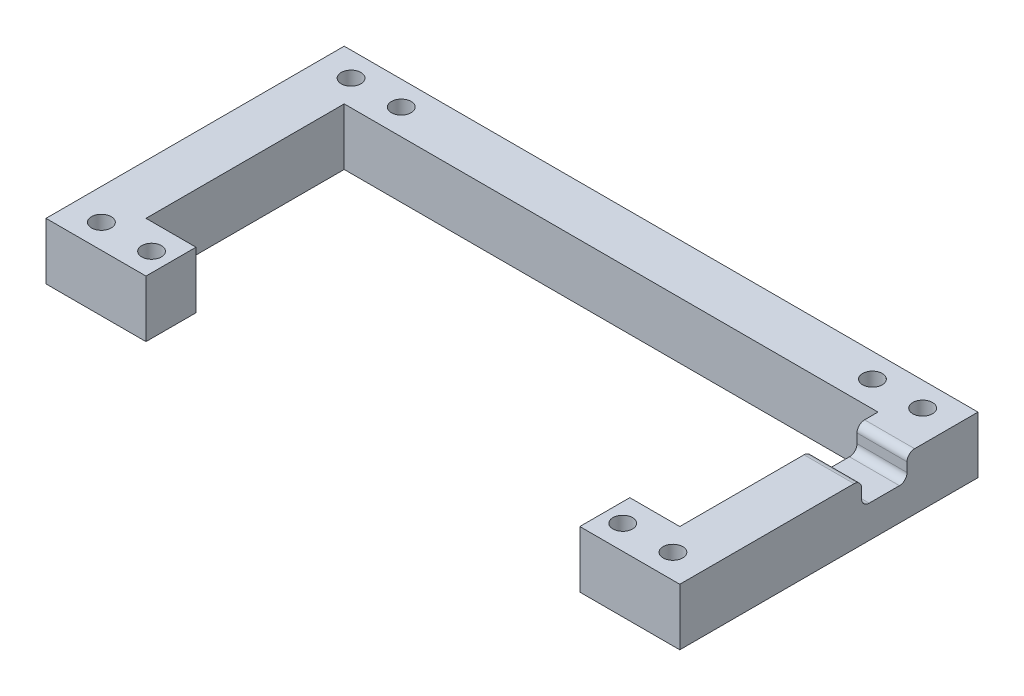
from build123d import *

# Parameters (mm, degrees)
SKETCH1_R           = 1.651
BOSS_EXTRUDE1_DEPTH = 9.525
SKETCH2_W           = 7.62
SKETCH2_H           = 4.099575227
CUT_EXTRUDE7_DEPTH  = 8.89
FILLET2_R           = 1.27


with BuildPart() as part:
    # Sketch1 → Boss-Extrude1 (new body)
    with BuildSketch(Plane(origin=(0, 0, 0), x_dir=(1, 0, 0), z_dir=(0, 1, 0))):
        Polygon((75.155177047, 61.997896552), (75.155177047, 11.997896552), (91.919177047, 11.997896552), (91.919177047, 20.379896552), (83.537177047, 20.379896552), (83.537177047, 53.615896552), (173.037829354, 53.615896552), (173.037829354, 20.379896552), (164.655829354, 20.379896552), (164.655829354, 11.997896552), (181.419829354, 11.997896552), (181.419829354, 61.997896552), align=None)
        with Locations((80.3721812, 16.064784874)):
            Circle(SKETCH1_R, mode=Mode.SUBTRACT)
        with Locations((80.3721812, 57.93100823)):
            Circle(SKETCH1_R, mode=Mode.SUBTRACT)
        with Locations((167.7875512, 57.93100823)):
            Circle(SKETCH1_R, mode=Mode.SUBTRACT)
        with Locations((88.7874552, 57.93100823)):
            Circle(SKETCH1_R, mode=Mode.SUBTRACT)
        with Locations((88.7874552, 16.064784874)):
            Circle(SKETCH1_R, mode=Mode.SUBTRACT)
        with Locations((176.2028252, 57.93100823)):
            Circle(SKETCH1_R, mode=Mode.SUBTRACT)
        with Locations((176.2028252, 16.064784874)):
            Circle(SKETCH1_R, mode=Mode.SUBTRACT)
        with Locations((167.7875512, 16.064784874)):
            Circle(SKETCH1_R, mode=Mode.SUBTRACT)
    extrude(amount=BOSS_EXTRUDE1_DEPTH)

    # Sketch2 → Cut-Extrude7 (cut)
    with BuildSketch(Plane(origin=(181.419829354, 0, 0), x_dir=(0, 0, -1), z_dir=(1, 0, 0))):
        with Locations((46.287896552, 7.475212387)):
            Rectangle(SKETCH2_W, SKETCH2_H)
    extrude(amount=-CUT_EXTRUDE7_DEPTH, mode=Mode.SUBTRACT)

    # Fillet2
    fillet2_edges = [part.edges().sort_by_distance(p)[0] for p in [
        (177.228829354, 5.425424773, -42.477896552),
        (177.228829354, 9.525, -42.477896552),
        (177.228829354, 9.525, -50.097896552),
        (177.228829354, 5.425424773, -50.097896552),
    ]]
    fillet(fillet2_edges, radius=FILLET2_R)


solid = part.part
